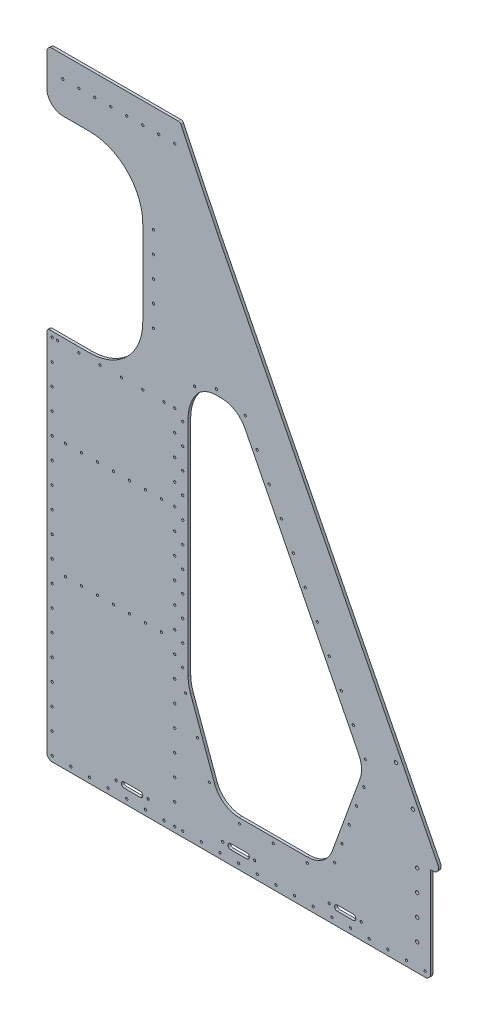
from build123d import *

# Parameters (mm, degrees)
SKETCH1_W           = 720
SKETCH1_H           = 1160
BOSS_EXTRUDE1_DEPTH = 5
FILLET1_R           = 10
CUT_EXTRUDE1_DEPTH  = 683.6602376
SKETCH3_W           = 360
SKETCH3_H           = 360
CUT_EXTRUDE2_DEPTH  = 683.6602376
FILLET2_R           = 100
BOSS_EXTRUDE2_DEPTH = 5
FILLET3_R           = 10
CUT_EXTRUDE5_DEPTH  = 691.712208801
FILLET6_R           = 50
FILLET7_R           = 50
BOSS_EXTRUDE3_DEPTH = 5
SKETCH10_W          = 50
SKETCH10_H          = 680
BOSS_EXTRUDE4_DEPTH = 5
BOSS_EXTRUDE5_DEPTH = 5
FILLET8_R           = 20
FILLET9_R           = 100
FILLET10_R          = 10
SKETCH12_R          = 2.1
CUT_EXTRUDE6_DEPTH  = 691.71220894
FILLET11_R          = 80
SKETCH13_R          = 3.1
CUT_EXTRUDE7_DEPTH  = 691.71220894
SKETCH14_R          = 2.1
CUT_EXTRUDE8_DEPTH  = 691.71220894
SKETCH15_R          = 2.1
CUT_EXTRUDE9_DEPTH  = 691.71220894
SKETCH16_R          = 2.1
CUT_EXTRUDE10_DEPTH = 691.71220894
SKETCH17_R          = 3.1
CUT_EXTRUDE11_DEPTH = 691.71220894
SKETCH18_R          = 2.1
CUT_EXTRUDE12_DEPTH = 691.71220894
SKETCH19_R          = 2.1
CUT_EXTRUDE13_DEPTH = 691.71220894
SKETCH20_W          = 68.394662623
SKETCH20_H          = 187.421855634
BOSS_EXTRUDE6_DEPTH = 5
FILLET12_R          = 30
SKETCH22_R          = 2.1
CUT_EXTRUDE14_DEPTH = 691.712208801
FILLET13_R          = 5
SKETCH26_R          = 2.1
CUT_EXTRUDE15_DEPTH = 691.712208801
SKETCH27_R          = 2.1
CUT_EXTRUDE16_DEPTH = 691.712208801


with BuildPart() as part:
    # Sketch1 → Boss-Extrude1 (new body)
    with BuildSketch(Plane.XY):
        Rectangle(SKETCH1_W, SKETCH1_H)
    extrude(amount=BOSS_EXTRUDE1_DEPTH)

    # Fillet1
    fillet1_edges = [part.edges().sort_by_distance(p)[0] for p in [
        (360, -580, 2.5),
        (-360, -580, 2.5),
        (-360, 580, 2.5),
        (360, 580, 2.5),
    ]]
    fillet(fillet1_edges, radius=FILLET1_R)

    # Sketch2 → Cut-Extrude1 (cut, through all)
    with BuildSketch(Plane(origin=(0, 0, 0), x_dir=(-1, 0, 0), z_dir=(0, 0, -1))):
        Polygon((-360, -400), (110, 580), (-360, 580), align=None)
    extrude(amount=-CUT_EXTRUDE1_DEPTH, mode=Mode.SUBTRACT)

    # Sketch3 → Cut-Extrude2 (cut, through all)
    with BuildSketch(Plane.XY.offset(5)):
        with Locations((-360, 300)):
            Rectangle(SKETCH3_W, SKETCH3_H)
    extrude(amount=-CUT_EXTRUDE2_DEPTH, mode=Mode.SUBTRACT)

    # Fillet2
    fillet2_edges = [part.edges().sort_by_distance(p)[0] for p in [
        (-180, 120, 2.5),
        (-180, 480, 2.5),
    ]]
    fillet(fillet2_edges, radius=FILLET2_R)

    # Sketch4 → Boss-Extrude2 (add)
    with BuildSketch(Plane(origin=(0, 0, 0), x_dir=(-1, 0, 0), z_dir=(0, 0, -1))):
        Polygon((-360, -400), (-381.299239221, -400), (39.887910056, 433.808833734), align=None)
    extrude(amount=-BOSS_EXTRUDE2_DEPTH)

    # Fillet3
    fillet3_edges = [part.edges().sort_by_distance(p)[0] for p in [
        (381.299239221, -400, 2.5),
    ]]
    fillet(fillet3_edges, radius=FILLET3_R)

    # Sketch8 → Cut-Extrude5 (cut, through all)
    with BuildSketch(Plane(origin=(0, 0, 0), x_dir=(-1, 0, 0), z_dir=(0, 0, -1))):
        Polygon((-157.260531971, -145), (-235, -298.897988777), (-163.624705035, -495), (-65, -495), (-65, -145), align=None)
        Polygon((221.746403662, 21.860119087), (105, -298.897988777), (27.260531971, -145), (-157.260531971, -145), (1.937250728, 170.158042579), (61.462906267, 170.158042579), align=None)
        Polygon((27.260531971, -145), (-65, -145), (-65, -495), (33.624705035, -495), (105, -298.897988777), align=None)
    extrude(amount=-CUT_EXTRUDE5_DEPTH, mode=Mode.SUBTRACT)

    # Fillet6
    fillet6_edges = [part.edges().sort_by_distance(p)[0] for p in [
        (-221.746403662, 21.860119087, 2.5),
        (-33.624705035, -495, 2.5),
        (163.624705035, -495, 2.5),
        (235, -298.897988777, 2.5),
        (-61.462906267, 170.158042579, 2.5),
    ]]
    fillet(fillet6_edges, radius=FILLET6_R)

    # Fillet7
    fillet7_edges = [part.edges().sort_by_distance(p)[0] for p in [
        (-1.937250728, 170.158042579, 2.5),
    ]]
    fillet(fillet7_edges, radius=FILLET7_R)

    # Sketch9 → Boss-Extrude3 (add)
    with BuildSketch(Plane(origin=(0, 0, 0), x_dir=(-1, 0, 0), z_dir=(0, 0, -1))):
        Polygon((130, 100), (110, 100), (110, -285.160601679), (130, -230.21105329), align=None)
        Polygon((110, 120), (110, 100), (130, 100), (137.291186057, 100), (115.674767753, 120), align=None)
    extrude(amount=-BOSS_EXTRUDE3_DEPTH)

    # Sketch10 → Boss-Extrude4 (add)
    with BuildSketch(Plane(origin=(0, 0, 0), x_dir=(-1, 0, 0), z_dir=(0, 0, -1))):
        with Locations((120, -65.105526645)):
            Rectangle(SKETCH10_W, SKETCH10_H)
    extrude(amount=-BOSS_EXTRUDE4_DEPTH)

    # Sketch11 → Boss-Extrude5 (add)
    with BuildSketch(Plane(origin=(0, 0, 0), x_dir=(-1, 0, 0), z_dir=(0, 0, -1))):
        Polygon((145, 10.590837072), (187.73624833, 53.327085402), (145, 92.867630674), align=None)
    extrude(amount=-BOSS_EXTRUDE5_DEPTH)

    # Fillet8
    fillet8_edges = [part.edges().sort_by_distance(p)[0] for p in [
        (-187.73624833, 53.327085402, 2.5),
    ]]
    fillet(fillet8_edges, radius=FILLET8_R)

    # Fillet9
    # the kernel refuses this fillet: 100 mm, written as the material it adds along each edge
    with BuildSketch(Plane(origin=(-145, 10.590837072, 0), x_dir=(-0.7071067811865508, 0.7071067811865444, 0), z_dir=(0, 0, 1))) as fillet9_piece_1:
        with BuildLine():
            CenterArc((41.425014476, 99.996341761), FILLET9_R, 225, 44.509910946)
            Line((-29.285663642, 29.285663642), (-30.699877205, 27.87145008))
            Line((-30.699877205, 27.87145008), (-1.414213562, -1.414213562))
            Line((-1.414213562, -1.414213562), (0, -2))
            Line((0, -2), (40.552551018, -1.999926835))
            Line((40.552551018, -1.999926835), (40.569658144, 0))
        make_face()
    extrude(amount=5)

    # Fillet10
    fillet10_edges = [part.edges().sort_by_distance(p)[0] for p in [
        (-145, -188.998891999, 2.5),
    ]]
    fillet(fillet10_edges, radius=FILLET10_R)

    # Sketch12 → Cut-Extrude6 (cut, through all)
    with BuildSketch(Plane(origin=(0, 0, 0), x_dir=(-1, 0, 0), z_dir=(0, 0, -1))):
        with Locations((-237.732802544, -282.129047053)):
            Circle(SKETCH12_R)
        with Locations((-215.18892551, -237.49975613)):
            Circle(SKETCH12_R)
        with Locations((-192.645048475, -192.870465208)):
            Circle(SKETCH12_R)
        with Locations((-170.101171441, -148.241174285)):
            Circle(SKETCH12_R)
        with Locations((-147.557294406, -103.611883362)):
            Circle(SKETCH12_R)
        with Locations((-125.013417372, -58.98259244)):
            Circle(SKETCH12_R)
        with Locations((-102.469540337, -14.353301517)):
            Circle(SKETCH12_R)
        with Locations((-79.925663303, 30.275989405)):
            Circle(SKETCH12_R)
        with Locations((-57.381786268, 74.905280328)):
            Circle(SKETCH12_R)
        with Locations((-34.837909234, 119.534571251)):
            Circle(SKETCH12_R)
        with Locations((-12.294032199, 164.163862173)):
            Circle(SKETCH12_R)
    extrude(amount=-CUT_EXTRUDE6_DEPTH, mode=Mode.SUBTRACT)

    # Fillet11
    # the kernel refuses this fillet: 80 mm, written as the material it adds along each edge
    with BuildSketch(Plane(origin=(-95, -326.372762971, 5), x_dir=(0.34202014332567043, -0.9396926207859078, 0), z_dir=(0, 0, -1))) as fillet11_piece_1:
        with BuildLine():
            CenterArc((FILLET11_R * 0.176326980708, -FILLET11_R), FILLET11_R, 90, 20)
            Line((-FILLET11_R * 0.165693162617, -FILLET11_R * 0.0603073792141), (0, 0))
            Line((0, 0), (FILLET11_R * 0.176326980708, 0))
        make_face()
    extrude(amount=5)
    with BuildSketch(Plane(origin=(-95, 139.128763573, 0), x_dir=(0, -1, 0), z_dir=(0, 0, 1))) as fillet11_piece_2:
        with BuildLine():
            CenterArc((34.220542128, 80), FILLET11_R, 229.504826403, 40.495173597)
            Line((-17.730177232, 19.163146383), (0, 0))
            Line((0, 0), (34.220542128, 0))
        make_face()
    extrude(amount=5)

    # Sketch13 → Cut-Extrude7 (cut, through all)
    with BuildSketch(Plane(origin=(0, 0, 0), x_dir=(-1, 0, 0), z_dir=(0, 0, -1))):
        with Locations((-295.119528739, -258.298431639)):
            Circle(SKETCH13_R)
        with Locations((-326.902073438, -318.41390263)):
            Circle(SKETCH13_R)
    extrude(amount=-CUT_EXTRUDE7_DEPTH, mode=Mode.SUBTRACT)

    # Sketch14 → Cut-Extrude8 (cut, through all)
    with BuildSketch(Plane.XY.offset(5)):
        with Locations((-340, 110)):
            Circle(SKETCH14_R)
        with Locations((-300, 110)):
            Circle(SKETCH14_R)
        with Locations((-260, 110)):
            Circle(SKETCH14_R)
        with Locations((-220, 110)):
            Circle(SKETCH14_R)
        with Locations((-180, 110)):
            Circle(SKETCH14_R)
        with Locations((-140, 110)):
            Circle(SKETCH14_R)
    extrude(amount=-CUT_EXTRUDE8_DEPTH, mode=Mode.SUBTRACT)

    # Sketch15 → Cut-Extrude9 (cut, through all)
    with BuildSketch(Plane.XY.offset(5)):
        with Locations((-350, -570)):
            Circle(SKETCH15_R)
        with Locations((-350, -530)):
            Circle(SKETCH15_R)
        with Locations((-350, -490)):
            Circle(SKETCH15_R)
        with Locations((-350, -450)):
            Circle(SKETCH15_R)
        with Locations((-350, -410)):
            Circle(SKETCH15_R)
        with Locations((-350, -370)):
            Circle(SKETCH15_R)
        with Locations((-350, -330)):
            Circle(SKETCH15_R)
        with Locations((-350, -290)):
            Circle(SKETCH15_R)
        with Locations((-350, -250)):
            Circle(SKETCH15_R)
        with Locations((-350, -210)):
            Circle(SKETCH15_R)
        with Locations((-350, -170)):
            Circle(SKETCH15_R)
        with Locations((-350, -130)):
            Circle(SKETCH15_R)
        with Locations((-350, -90)):
            Circle(SKETCH15_R)
        with Locations((-350, -50)):
            Circle(SKETCH15_R)
        with Locations((-350, -10)):
            Circle(SKETCH15_R)
        with Locations((-350, 30)):
            Circle(SKETCH15_R)
        with Locations((-350, 70)):
            Circle(SKETCH15_R)
        with Locations((-350, 110)):
            Circle(SKETCH15_R)
        with Locations((-120, -570)):
            Circle(SKETCH15_R)
        with Locations((-120, -530)):
            Circle(SKETCH15_R)
        with Locations((-120, -490)):
            Circle(SKETCH15_R)
        with Locations((-120, -450)):
            Circle(SKETCH15_R)
        with Locations((-120, -410)):
            Circle(SKETCH15_R)
        with Locations((-120, -370)):
            Circle(SKETCH15_R)
        with Locations((-120, -330)):
            Circle(SKETCH15_R)
        with Locations((-120, -290)):
            Circle(SKETCH15_R)
        with Locations((-120, -250)):
            Circle(SKETCH15_R)
        with Locations((-120, -210)):
            Circle(SKETCH15_R)
        with Locations((-120, -170)):
            Circle(SKETCH15_R)
        with Locations((-120, -130)):
            Circle(SKETCH15_R)
        with Locations((-120, -90)):
            Circle(SKETCH15_R)
        with Locations((-120, -50)):
            Circle(SKETCH15_R)
        with Locations((-120, -10)):
            Circle(SKETCH15_R)
        with Locations((-120, 30)):
            Circle(SKETCH15_R)
        with Locations((-120, 70)):
            Circle(SKETCH15_R)
        with Locations((-120, 110)):
            Circle(SKETCH15_R)
    extrude(amount=-CUT_EXTRUDE9_DEPTH, mode=Mode.SUBTRACT)

    # Sketch16 → Cut-Extrude10 (cut, through all)
    with BuildSketch(Plane.XY.offset(5)):
        with Locations((-315, -570)):
            Circle(SKETCH16_R)
        with Locations((-280, -570)):
            Circle(SKETCH16_R)
        with Locations((-245, -570)):
            Circle(SKETCH16_R)
        with Locations((-210, -570)):
            Circle(SKETCH16_R)
        with Locations((-175, -570)):
            Circle(SKETCH16_R)
        with Locations((-140, -570)):
            Circle(SKETCH16_R)
        with Locations((-105, -570)):
            Circle(SKETCH16_R)
        with Locations((-70, -570)):
            Circle(SKETCH16_R)
        with Locations((-35, -570)):
            Circle(SKETCH16_R)
        with Locations((0, -570)):
            Circle(SKETCH16_R)
        with Locations((35, -570)):
            Circle(SKETCH16_R)
        with Locations((70, -570)):
            Circle(SKETCH16_R)
        with Locations((105, -570)):
            Circle(SKETCH16_R)
        with Locations((140, -570)):
            Circle(SKETCH16_R)
        with Locations((175, -570)):
            Circle(SKETCH16_R)
        with Locations((210, -570)):
            Circle(SKETCH16_R)
        with Locations((245, -570)):
            Circle(SKETCH16_R)
        with Locations((280, -570)):
            Circle(SKETCH16_R)
        with Locations((315, -570)):
            Circle(SKETCH16_R)
        with Locations((350, -570)):
            Circle(SKETCH16_R)
    extrude(amount=-CUT_EXTRUDE10_DEPTH, mode=Mode.SUBTRACT)

    # Sketch17 → Cut-Extrude11 (cut, through all)
    with BuildSketch(Plane(origin=(0, 0, 0), x_dir=(-1, 0, 0), z_dir=(0, 0, -1))):
        with Locations((-335, -410)):
            Circle(SKETCH17_R)
        with Locations((-335, -450)):
            Circle(SKETCH17_R)
        with Locations((-335, -490)):
            Circle(SKETCH17_R)
        with Locations((-335, -530)):
            Circle(SKETCH17_R)
    extrude(amount=-CUT_EXTRUDE11_DEPTH, mode=Mode.SUBTRACT)

    # Sketch18 → Cut-Extrude12 (cut, through all)
    with BuildSketch(Plane(origin=(0, 0, 0), x_dir=(-1, 0, 0), z_dir=(0, 0, -1))):
        with Locations((-234.944538726, -328.288411377)):
            Circle(SKETCH18_R)
        with Locations((-221.263732993, -365.876116209)):
            Circle(SKETCH18_R)
        with Locations((-207.58292726, -403.46382104)):
            Circle(SKETCH18_R)
        with Locations((-193.902121527, -441.051525871)):
            Circle(SKETCH18_R)
        with Locations((-180.221315794, -478.639230703)):
            Circle(SKETCH18_R)
        with Locations((-128.614328125, -505)):
            Circle(SKETCH18_R)
        with Locations((-65, -505)):
            Circle(SKETCH18_R)
        with Locations((-1.385671875, -505)):
            Circle(SKETCH18_R)
        with Locations((54.995885372, -465.5212086)):
            Circle(SKETCH18_R)
        with Locations((77.284110621, -404.284813007)):
            Circle(SKETCH18_R)
        with Locations((99.572335871, -343.048417414)):
            Circle(SKETCH18_R)
        with Locations((105, -304.266604515)):
            Circle(SKETCH18_R)
        with Locations((105, -264.266604515)):
            Circle(SKETCH18_R)
        with Locations((105, -224.266604515)):
            Circle(SKETCH18_R)
        with Locations((105, -184.266604515)):
            Circle(SKETCH18_R)
        with Locations((105, -144.266604515)):
            Circle(SKETCH18_R)
        with Locations((105, -104.266604515)):
            Circle(SKETCH18_R)
        with Locations((105, -64.266604515)):
            Circle(SKETCH18_R)
        with Locations((105, -24.266604515)):
            Circle(SKETCH18_R)
        with Locations((105, 15.733395485)):
            Circle(SKETCH18_R)
        with Locations((105, 55.733395485)):
            Circle(SKETCH18_R)
        with Locations((105, 95.733395485)):
            Circle(SKETCH18_R)
        with Locations((41.880351009, 180.158042579)):
            Circle(SKETCH18_R)
        with Locations((82.628154139, 164.199120451)):
            Circle(SKETCH18_R)
    extrude(amount=-CUT_EXTRUDE12_DEPTH, mode=Mode.SUBTRACT)

    # Sketch19 → Cut-Extrude13 (cut, through all)
    with BuildSketch(Plane(origin=(0, 0, 0), x_dir=(-1, 0, 0), z_dir=(0, 0, -1))):
        with Locations((160, 380)):
            Circle(SKETCH19_R)
        with Locations((160, 340)):
            Circle(SKETCH19_R)
        with Locations((160, 300)):
            Circle(SKETCH19_R)
        with Locations((160, 260)):
            Circle(SKETCH19_R)
        with Locations((160, 220)):
            Circle(SKETCH19_R)
    extrude(amount=-CUT_EXTRUDE13_DEPTH, mode=Mode.SUBTRACT)

    # Sketch20 → Boss-Extrude6 (add)
    with BuildSketch(Plane.XY.offset(5)):
        with Locations((-179.197331312, -48.575145985)):
            Rectangle(SKETCH20_W, SKETCH20_H)
    extrude(amount=-BOSS_EXTRUDE6_DEPTH)

    # Fillet12
    fillet12_edges = [part.edges().sort_by_distance(p)[0] for p in [
        (-360, 480, 2.5),
    ]]
    fillet(fillet12_edges, radius=FILLET12_R)

    # Sketch22 → Cut-Extrude14 (cut, through all)
    with BuildSketch(Plane(origin=(0, 0, 0), x_dir=(-1, 0, 0), z_dir=(0, 0, -1))):
        with Locations((-230, -550)):
            Circle(SKETCH22_R)
        with Locations(Location((-170, -550, 0), (0, 0, 180))):
            Circle(SKETCH22_R)
        with Locations((-30, -550)):
            Circle(SKETCH22_R)
        with Locations(Location((30, -550, 0), (0, 0, 180))):
            Circle(SKETCH22_R)
        with Locations((170, -550)):
            Circle(SKETCH22_R)
        with Locations(Location((230, -550, 0), (0, 0, 180))):
            Circle(SKETCH22_R)
        with BuildLine():
            Line((-215, -545), (-185, -545))
            ThreePointArc((-185, -545), (-180, -550), (-185, -555))
            Line((-185, -555), (-215, -555))
            ThreePointArc((-215, -555), (-220, -550), (-215, -545))
        make_face()
        with BuildLine():
            Line((-15, -545), (15, -545))
            ThreePointArc((15, -545), (20, -550), (15, -555))
            Line((15, -555), (-15, -555))
            ThreePointArc((-15, -555), (-20, -550), (-15, -545))
        make_face()
        with BuildLine():
            Line((185, -545), (215, -545))
            ThreePointArc((215, -545), (220, -550), (215, -555))
            Line((215, -555), (185, -555))
            ThreePointArc((185, -555), (180, -550), (185, -545))
        make_face()
    extrude(amount=-CUT_EXTRUDE14_DEPTH, mode=Mode.SUBTRACT)

    # Fillet13
    fillet13_edges = [part.edges().sort_by_distance(p)[0] for p in [
        (-110, 580, 2.5),
        (-360, 120, 2.5),
    ]]
    fillet(fillet13_edges, radius=FILLET13_R)

    # Sketch26 → Cut-Extrude15 (cut, through all)
    with BuildSketch(Plane(origin=(0, 0, 0), x_dir=(-1, 0, 0), z_dir=(0, 0, -1))):
        with Locations((120, 540)):
            Circle(SKETCH26_R)
        with Locations((150, 540)):
            Circle(SKETCH26_R)
        with Locations((180, 540)):
            Circle(SKETCH26_R)
        with Locations((210, 540)):
            Circle(SKETCH26_R)
        with Locations((240, 540)):
            Circle(SKETCH26_R)
        with Locations((270, 540)):
            Circle(SKETCH26_R)
        with Locations((300, 540)):
            Circle(SKETCH26_R)
        with Locations((330, 540)):
            Circle(SKETCH26_R)
    extrude(amount=-CUT_EXTRUDE15_DEPTH, mode=Mode.SUBTRACT)

    # Sketch27 → Cut-Extrude16 (cut, through all)
    with BuildSketch(Plane(origin=(0, 0, 0), x_dir=(-1, 0, 0), z_dir=(0, 0, -1))):
        with Locations((145, -50)):
            Circle(SKETCH27_R)
        with Locations((175, -50)):
            Circle(SKETCH27_R)
        with Locations((265, -50)):
            Circle(SKETCH27_R)
        with Locations((295, -50)):
            Circle(SKETCH27_R)
        with Locations((325, -50)):
            Circle(SKETCH27_R)
        with Locations((145, -266.5)):
            Circle(SKETCH27_R)
        with Locations((175, -266.5)):
            Circle(SKETCH27_R)
        with Locations((205, -266.5)):
            Circle(SKETCH27_R)
        with Locations((235, -266.5)):
            Circle(SKETCH27_R)
        with Locations((265, -266.5)):
            Circle(SKETCH27_R)
        with Locations((295, -266.5)):
            Circle(SKETCH27_R)
        with Locations((325, -266.5)):
            Circle(SKETCH27_R)
        with Locations((205, -50)):
            Circle(SKETCH27_R)
        with Locations((235, -50)):
            Circle(SKETCH27_R)
    extrude(amount=-CUT_EXTRUDE16_DEPTH, mode=Mode.SUBTRACT)


solid = part.part
